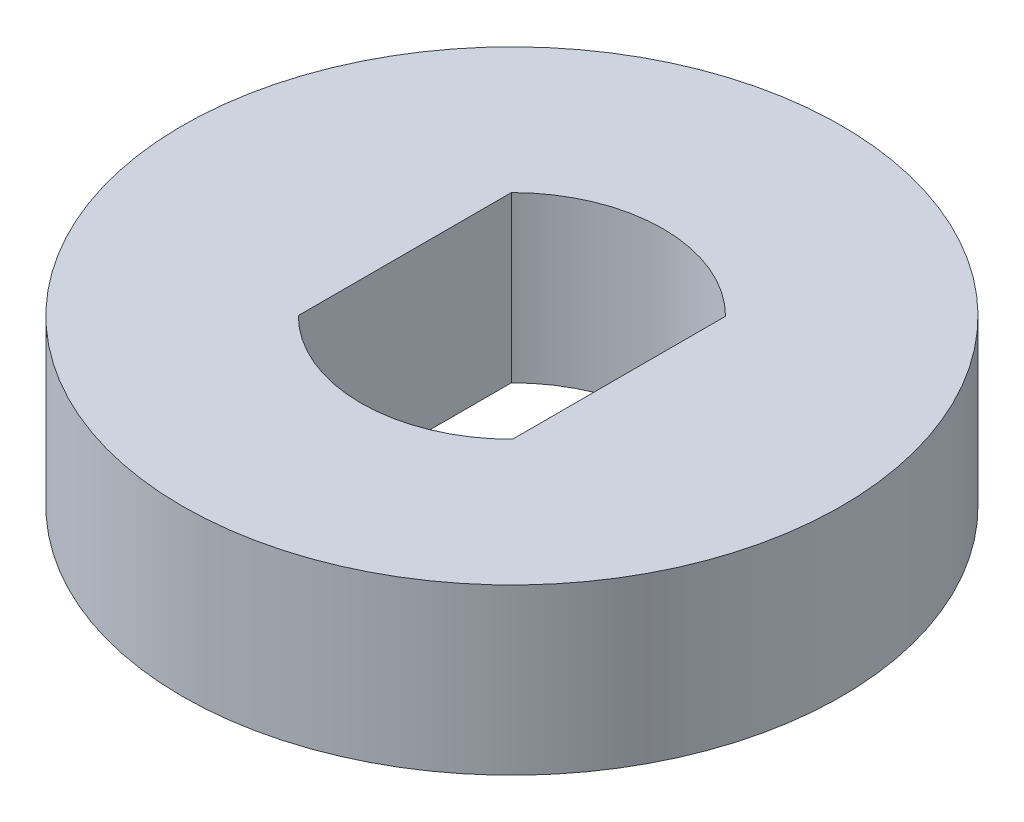
from build123d import *

# Parameters (mm, degrees)
SKETCH1_R           = 6
BOSS_EXTRUDE1_DEPTH = 3


with BuildPart() as part:
    # Sketch1 → Boss-Extrude1 (new body)
    with BuildSketch(Plane(origin=(0, 0, 0), x_dir=(1, 0, 0), z_dir=(0, 1, 0))):
        Circle(SKETCH1_R)
        with BuildLine():
            ThreePointArc((-1.95, 1.939071943), (0, 2.75), (1.95, 1.939071943))
            Line((1.95, 1.939071943), (1.95, -1.939071943))
            ThreePointArc((1.95, -1.939071943), (0, -2.75), (-1.95, -1.939071943))
            Line((-1.95, -1.939071943), (-1.95, 1.939071943))
        make_face(mode=Mode.SUBTRACT)
    extrude(amount=BOSS_EXTRUDE1_DEPTH)


solid = part.part
